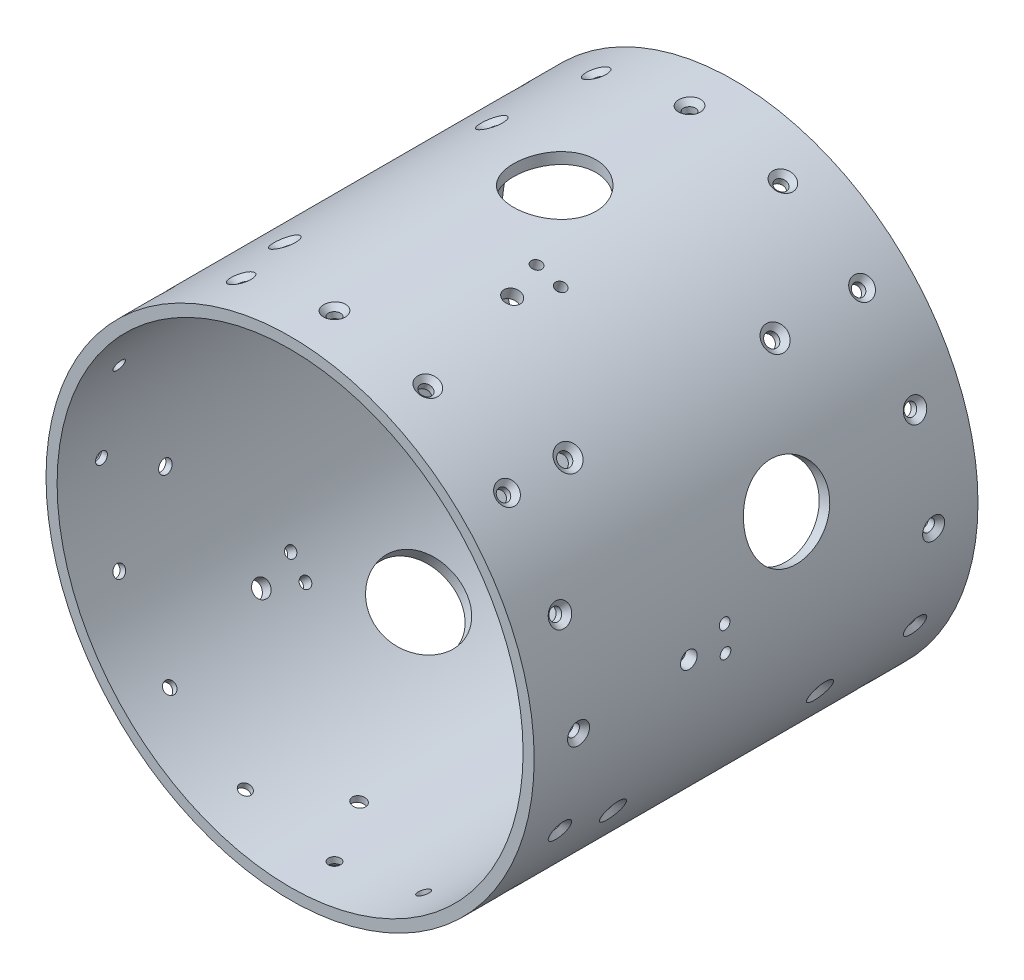
from build123d import *

# Parameters (mm, degrees)
SKETCH1_R                                       = 69.85
SKETCH1_R_2                                     = 66.675
EXTRUDE1_DEPTH                                  = 63.5
CSK_FOR_M3_FLAT_HEAD_MACHINE_SCREW1_D           = 3.4
CSK_FOR_M3_FLAT_HEAD_MACHINE_SCREW1_CSINK_D     = 6.3
CSK_FOR_M3_FLAT_HEAD_MACHINE_SCREW1_CSINK_ANGLE = 90
CIRPATTERN1_COUNT                               = 16
MIRROR1_COPY_1_D                                = 3.4
MIRROR1_COPY_1_CSINK_D                          = 6.3
MIRROR1_COPY_1_CSINK_ANGLE                      = 90
MIRROR1_COPY_2_D                                = 3.4
MIRROR1_COPY_2_CSINK_D                          = 6.3
MIRROR1_COPY_2_CSINK_ANGLE                      = 90
MIRROR1_COPY_3_D                                = 3.4
MIRROR1_COPY_3_CSINK_D                          = 6.3
MIRROR1_COPY_3_CSINK_ANGLE                      = 90
MIRROR1_COPY_4_D                                = 3.4
MIRROR1_COPY_4_CSINK_D                          = 6.3
MIRROR1_COPY_4_CSINK_ANGLE                      = 90
MIRROR1_COPY_5_D                                = 3.4
MIRROR1_COPY_5_CSINK_D                          = 6.3
MIRROR1_COPY_5_CSINK_ANGLE                      = 90
MIRROR1_COPY_6_D                                = 3.4
MIRROR1_COPY_6_CSINK_D                          = 6.3
MIRROR1_COPY_6_CSINK_ANGLE                      = 90
MIRROR1_COPY_7_D                                = 3.4
MIRROR1_COPY_7_CSINK_D                          = 6.3
MIRROR1_COPY_7_CSINK_ANGLE                      = 90
MIRROR1_COPY_8_D                                = 3.4
MIRROR1_COPY_8_CSINK_D                          = 6.3
MIRROR1_COPY_8_CSINK_ANGLE                      = 90
MIRROR1_COPY_9_D                                = 3.4
MIRROR1_COPY_9_CSINK_D                          = 6.3
MIRROR1_COPY_9_CSINK_ANGLE                      = 90
MIRROR1_COPY_10_D                               = 3.4
MIRROR1_COPY_10_CSINK_D                         = 6.3
MIRROR1_COPY_10_CSINK_ANGLE                     = 90
MIRROR1_COPY_11_D                               = 3.4
MIRROR1_COPY_11_CSINK_D                         = 6.3
MIRROR1_COPY_11_CSINK_ANGLE                     = 90
MIRROR1_COPY_12_D                               = 3.4
MIRROR1_COPY_12_CSINK_D                         = 6.3
MIRROR1_COPY_12_CSINK_ANGLE                     = 90
MIRROR1_COPY_13_D                               = 3.4
MIRROR1_COPY_13_CSINK_D                         = 6.3
MIRROR1_COPY_13_CSINK_ANGLE                     = 90
MIRROR1_COPY_14_D                               = 3.4
MIRROR1_COPY_14_CSINK_D                         = 6.3
MIRROR1_COPY_14_CSINK_ANGLE                     = 90
MIRROR1_COPY_15_D                               = 3.4
MIRROR1_COPY_15_CSINK_D                         = 6.3
MIRROR1_COPY_15_CSINK_ANGLE                     = 90
SKETCH16_R                                      = 11.8
CUT_EXTRUDE1_DEPTH                              = 7.62
CSK_FOR_6_FLAT_HEAD_MACHINE_SCREW_2_COUNT       = 2
CSK_FOR_6_FLAT_HEAD_MACHINE_SCREW_2_PITCH       = 59.24296
CIRPATTERN2_COUNT                               = 5


with BuildPart() as part:
    # Sketch1 → Extrude1 (new body)
    with BuildSketch(Plane.XY):
        Circle(SKETCH1_R)
        Circle(SKETCH1_R_2, mode=Mode.SUBTRACT)
    extrude1 = extrude(amount=EXTRUDE1_DEPTH)

    # CSK for M3 Flat Head Machine Screw1 (through all)
    with Locations(Plane(origin=(0, -69.85, 50.8), x_dir=(1, 0, 0), z_dir=(0, -1, 0))):
        with Locations((0, 0)):
            csk_for_m3_flat_head_machine_screw1 = CounterSinkHole(CSK_FOR_M3_FLAT_HEAD_MACHINE_SCREW1_D / 2, CSK_FOR_M3_FLAT_HEAD_MACHINE_SCREW1_CSINK_D / 2, counter_sink_angle=CSK_FOR_M3_FLAT_HEAD_MACHINE_SCREW1_CSINK_ANGLE)

    # CirPattern1: CSK for M3 Flat Head Machine Screw1 ×16 about axis
    cirpattern1_axis = Axis((0, 0, 63.5), (0, 0, -1))
    for i in range(1, CIRPATTERN1_COUNT):
        add(csk_for_m3_flat_head_machine_screw1.rotate(cirpattern1_axis, i * 360 / CIRPATTERN1_COUNT), mode=Mode.SUBTRACT)

    # Mirror1: Extrude1, CSK for M3 Flat Head Machine Screw1 across plane
    add(extrude1.mirror(Plane.XY))
    add(csk_for_m3_flat_head_machine_screw1.mirror(Plane.XY), mode=Mode.SUBTRACT)

    # Mirror1 copy 1 (through all)
    with Locations(Plane(origin=(-26.730437751, -64.532985346, -50.8), x_dir=(0.9238795325112868, -0.3826834323650896, 0), z_dir=(-0.3826834323650896, -0.9238795325112868, 0))):
        with Locations((0, 0)):
            CounterSinkHole(MIRROR1_COPY_1_D / 2, MIRROR1_COPY_1_CSINK_D / 2, counter_sink_angle=MIRROR1_COPY_1_CSINK_ANGLE)

    # Mirror1 copy 2 (through all)
    with Locations(Plane(origin=(-49.391408666, -49.391408666, -50.8), x_dir=(0.7071067811865477, -0.7071067811865474, 0), z_dir=(-0.7071067811865474, -0.7071067811865477, 0))):
        with Locations((0, 0)):
            CounterSinkHole(MIRROR1_COPY_2_D / 2, MIRROR1_COPY_2_CSINK_D / 2, counter_sink_angle=MIRROR1_COPY_2_CSINK_ANGLE)

    # Mirror1 copy 3 (through all)
    with Locations(Plane(origin=(-64.532985346, -26.730437751, -50.8), x_dir=(0.38268343236509, -0.9238795325112866, 0), z_dir=(-0.9238795325112866, -0.38268343236509, 0))):
        with Locations((0, 0)):
            CounterSinkHole(MIRROR1_COPY_3_D / 2, MIRROR1_COPY_3_CSINK_D / 2, counter_sink_angle=MIRROR1_COPY_3_CSINK_ANGLE)

    # Mirror1 copy 4 (through all)
    with Locations(Plane(origin=(-69.85, 0, -50.8), x_dir=(0, -1, 0), z_dir=(-1, 0, 0))):
        with Locations((0, 0)):
            CounterSinkHole(MIRROR1_COPY_4_D / 2, MIRROR1_COPY_4_CSINK_D / 2, counter_sink_angle=MIRROR1_COPY_4_CSINK_ANGLE)

    # Mirror1 copy 5 (through all)
    with Locations(Plane(origin=(-64.532985346, 26.730437751, -50.8), x_dir=(-0.38268343236508956, -0.9238795325112868, 0), z_dir=(-0.9238795325112868, 0.38268343236508956, 0))):
        with Locations((0, 0)):
            CounterSinkHole(MIRROR1_COPY_5_D / 2, MIRROR1_COPY_5_CSINK_D / 2, counter_sink_angle=MIRROR1_COPY_5_CSINK_ANGLE)

    # Mirror1 copy 6 (through all)
    with Locations(Plane(origin=(-49.391408666, 49.391408666, -50.8), x_dir=(-0.7071067811865474, -0.7071067811865477, 0), z_dir=(-0.7071067811865477, 0.7071067811865474, 0))):
        with Locations((0, 0)):
            CounterSinkHole(MIRROR1_COPY_6_D / 2, MIRROR1_COPY_6_CSINK_D / 2, counter_sink_angle=MIRROR1_COPY_6_CSINK_ANGLE)

    # Mirror1 copy 7 (through all)
    with Locations(Plane(origin=(-26.730437751, 64.532985346, -50.8), x_dir=(-0.9238795325112866, -0.38268343236509006, 0), z_dir=(-0.38268343236509006, 0.9238795325112866, 0))):
        with Locations((0, 0)):
            CounterSinkHole(MIRROR1_COPY_7_D / 2, MIRROR1_COPY_7_CSINK_D / 2, counter_sink_angle=MIRROR1_COPY_7_CSINK_ANGLE)

    # Mirror1 copy 8 (through all)
    with Locations(Plane(origin=(0, 69.85, -50.8), x_dir=(-1, 0, 0), z_dir=(0, 1, 0))):
        with Locations((0, 0)):
            CounterSinkHole(MIRROR1_COPY_8_D / 2, MIRROR1_COPY_8_CSINK_D / 2, counter_sink_angle=MIRROR1_COPY_8_CSINK_ANGLE)

    # Mirror1 copy 9 (through all)
    with Locations(Plane(origin=(26.730437751, 64.532985346, -50.8), x_dir=(-0.923879532511287, 0.3826834323650895, 0), z_dir=(0.3826834323650895, 0.923879532511287, 0))):
        with Locations((0, 0)):
            CounterSinkHole(MIRROR1_COPY_9_D / 2, MIRROR1_COPY_9_CSINK_D / 2, counter_sink_angle=MIRROR1_COPY_9_CSINK_ANGLE)

    # Mirror1 copy 10 (through all)
    with Locations(Plane(origin=(49.391408666, 49.391408666, -50.8), x_dir=(-0.7071067811865478, 0.7071067811865474, 0), z_dir=(0.7071067811865474, 0.7071067811865478, 0))):
        with Locations((0, 0)):
            CounterSinkHole(MIRROR1_COPY_10_D / 2, MIRROR1_COPY_10_CSINK_D / 2, counter_sink_angle=MIRROR1_COPY_10_CSINK_ANGLE)

    # Mirror1 copy 11 (through all)
    with Locations(Plane(origin=(64.532985346, 26.730437751, -50.8), x_dir=(-0.38268343236508967, 0.9238795325112867, 0), z_dir=(0.9238795325112867, 0.38268343236508967, 0))):
        with Locations((0, 0)):
            CounterSinkHole(MIRROR1_COPY_11_D / 2, MIRROR1_COPY_11_CSINK_D / 2, counter_sink_angle=MIRROR1_COPY_11_CSINK_ANGLE)

    # Mirror1 copy 12 (through all)
    with Locations(Plane(origin=(69.85, 0, -50.8), x_dir=(0, 1, 0), z_dir=(1, 0, 0))):
        with Locations((0, 0)):
            CounterSinkHole(MIRROR1_COPY_12_D / 2, MIRROR1_COPY_12_CSINK_D / 2, counter_sink_angle=MIRROR1_COPY_12_CSINK_ANGLE)

    # Mirror1 copy 13 (through all)
    with Locations(Plane(origin=(64.532985346, -26.730437751, -50.8), x_dir=(0.38268343236508984, 0.9238795325112867, 0), z_dir=(0.9238795325112867, -0.38268343236508984, 0))):
        with Locations((0, 0)):
            CounterSinkHole(MIRROR1_COPY_13_D / 2, MIRROR1_COPY_13_CSINK_D / 2, counter_sink_angle=MIRROR1_COPY_13_CSINK_ANGLE)

    # Mirror1 copy 14 (through all)
    with Locations(Plane(origin=(49.391408666, -49.391408666, -50.8), x_dir=(0.7071067811865472, 0.7071067811865478, 0), z_dir=(0.7071067811865478, -0.7071067811865472, 0))):
        with Locations((0, 0)):
            CounterSinkHole(MIRROR1_COPY_14_D / 2, MIRROR1_COPY_14_CSINK_D / 2, counter_sink_angle=MIRROR1_COPY_14_CSINK_ANGLE)

    # Mirror1 copy 15 (through all)
    with Locations(Plane(origin=(26.730437751, -64.532985346, -50.8), x_dir=(0.9238795325112867, 0.3826834323650897, 0), z_dir=(0.3826834323650897, -0.9238795325112867, 0))):
        with Locations((0, 0)):
            CounterSinkHole(MIRROR1_COPY_15_D / 2, MIRROR1_COPY_15_CSINK_D / 2, counter_sink_angle=MIRROR1_COPY_15_CSINK_ANGLE)

    # Sketch16 → Cut-Extrude1 (cut)
    with BuildSketch(Plane(origin=(0, 69.85, -63.5), x_dir=(-1, 0, 0), z_dir=(0, 1, 0))):
        with Locations((0, 51.27663989)):
            Circle(SKETCH16_R)
    cut_extrude1 = extrude(amount=-CUT_EXTRUDE1_DEPTH, mode=Mode.SUBTRACT)

    # Sketch23 → #31 (0.12) Diameter Hole1 (revolve, cut)
    with BuildSketch(Plane(origin=(15.77216824, 68.046022727, 8.74663989), x_dir=(-0.9741735537190066, 0.22580054746275913, 0), z_dir=(0, 0, 1))):
        Polygon((0, 0), (0, 12.599711583), (1.524, 11.684), (1.524, 0), align=None)
    f_31_0_12_diameter_hole1 = revolve(axis=Axis((17.206001717, 74.232024793, 8.74663989), (-0.22580054746275915, -0.9741735537190067, 0)), mode=Mode.SUBTRACT)

    # Sketch26 → 3/16 (0.1875) Diameter Hole1 (revolve, cut)
    with BuildSketch(Plane(origin=(19.257080823, 67.143036409, 19.19663989), x_dir=(-0.961246047368717, 0.27569192301918877, 0), z_dir=(0, 0, 1))):
        Polygon((0, 0), (0, 13.114799349), (2.38125, 11.684), (2.38125, 0), align=None)
    f_3_16_0_1875_diameter_hole1 = revolve(axis=Axis((21.007724534, 73.246948809, 19.19663989), (-0.27569192301918877, -0.961246047368717, 0)), mode=Mode.SUBTRACT)

    # Sketch28 → #31 (0.12) Diameter Hole3 (revolve, cut)
    with BuildSketch(Plane(origin=(22.693105761, 66.060922268, 8.74663989), x_dir=(-0.9457540768522393, 0.32488340388109804, 0), z_dir=(0, 0, 1))):
        Polygon((0, 0), (0, 12.599711583), (1.524, 11.684), (1.524, 0), align=None)
    f_31_0_12_diameter_hole3 = revolve(axis=Axis((24.756115376, 72.066460656, 8.74663989), (-0.32488340388109804, -0.9457540768522393, 0)), mode=Mode.SUBTRACT)

    # Sketch35 → CSK for #6 Flat Head Machine Screw (100)1 (revolve, cut)
    with BuildSketch(Plane(origin=(49.391408666, 49.391408666, 33.3375), x_dir=(-0.7071067811865409, 0.7071067811865542, 0), z_dir=(0, 0, 1))):
        Polygon((0, 0), (0, 16.380824014), (1.89865, 15.24), (1.89865, 1.380025208), (3.5433, 0), align=None)
    csk_for_6_flat_head_machine_screw_100 = revolve(axis=Axis((53.881536726, 53.881536726, 33.3375), (-0.7071067811865543, -0.7071067811865409, 0)), mode=Mode.SUBTRACT)

    # CSK for _6 Flat Head Machine Screw _ 2: CSK for #6 Flat Head Machine Screw (100)1 ×2
    with Locations(*[(0, 0, -i * CSK_FOR_6_FLAT_HEAD_MACHINE_SCREW_2_PITCH) for i in range(1, CSK_FOR_6_FLAT_HEAD_MACHINE_SCREW_2_COUNT)]):
        add(csk_for_6_flat_head_machine_screw_100, mode=Mode.SUBTRACT)

    # CirPattern2: Cut-Extrude1, #31 (0.12) Diameter Hole1, 3/16 (0.1875) Diameter Hole1, #31 (0.12) Diameter Hole3, CSK for #6 Flat Head Machine Screw (100)1 ×5 about axis
    cirpattern2_axis = Axis((0, 0, 63.5), (0, 0, -1))
    add([cut_extrude1.rotate(cirpattern2_axis, i * 360 / CIRPATTERN2_COUNT) for i in range(1, CIRPATTERN2_COUNT)], mode=Mode.SUBTRACT)
    add([f_31_0_12_diameter_hole1.rotate(cirpattern2_axis, i * 360 / CIRPATTERN2_COUNT) for i in range(1, CIRPATTERN2_COUNT)], mode=Mode.SUBTRACT)
    add([f_3_16_0_1875_diameter_hole1.rotate(cirpattern2_axis, i * 360 / CIRPATTERN2_COUNT) for i in range(1, CIRPATTERN2_COUNT)], mode=Mode.SUBTRACT)
    add([f_31_0_12_diameter_hole3.rotate(cirpattern2_axis, i * 360 / CIRPATTERN2_COUNT) for i in range(1, CIRPATTERN2_COUNT)], mode=Mode.SUBTRACT)
    add([csk_for_6_flat_head_machine_screw_100.rotate(cirpattern2_axis, i * 360 / CIRPATTERN2_COUNT) for i in range(1, CIRPATTERN2_COUNT)], mode=Mode.SUBTRACT)

    # CirPattern2 copy 1 sketch → CirPattern2 copy 1 (revolve, cut)
    with BuildSketch(Plane(origin=(62.236805715, -31.711236407, -25.90546), x_dir=(0.4539904997395552, 0.8910065241883637, 0), z_dir=(0, 0, 1))):
        Polygon((0, 0), (0, 16.380824014), (1.89865, 15.24), (1.89865, 1.380025208), (3.5433, 0), align=None)
    revolve(axis=Axis((67.894697143, -34.59407608, -25.90546), (-0.8910065241883637, 0.4539904997395553, 0)), mode=Mode.SUBTRACT)

    # CirPattern2 copy 2 sketch → CirPattern2 copy 2 (revolve, cut)
    with BuildSketch(Plane(origin=(-10.926947383, -68.990030591, -25.90546), x_dir=(0.9876883405951364, -0.15643446504024006, 0), z_dir=(0, 0, 1))):
        Polygon((0, 0), (0, 16.380824014), (1.89865, 15.24), (1.89865, 1.380025208), (3.5433, 0), align=None)
    revolve(axis=Axis((-11.920306236, -75.261851553, -25.90546), (0.15643446504024017, 0.9876883405951364, 0)), mode=Mode.SUBTRACT)

    # CirPattern2 copy 3 sketch → CirPattern2 copy 3 (revolve, cut)
    with BuildSketch(Plane(origin=(-68.990030591, -10.926947383, -25.90546), x_dir=(0.15643446504022174, -0.9876883405951393, 0), z_dir=(0, 0, 1))):
        Polygon((0, 0), (0, 16.380824014), (1.89865, 15.24), (1.89865, 1.380025208), (3.5433, 0), align=None)
    revolve(axis=Axis((-75.261851553, -11.920306236, -25.90546), (0.9876883405951393, 0.15643446504022168, 0)), mode=Mode.SUBTRACT)

    # CirPattern2 copy 4 sketch → CirPattern2 copy 4 (revolve, cut)
    with BuildSketch(Plane(origin=(-31.711236407, 62.236805715, -25.90546), x_dir=(-0.891006524188372, -0.4539904997395386, 0), z_dir=(0, 0, 1))):
        Polygon((0, 0), (0, 16.380824014), (1.89865, 15.24), (1.89865, 1.380025208), (3.5433, 0), align=None)
    revolve(axis=Axis((-34.59407608, 67.894697143, -25.90546), (0.45399049973953853, -0.8910065241883722, 0)), mode=Mode.SUBTRACT)


solid = part.part
